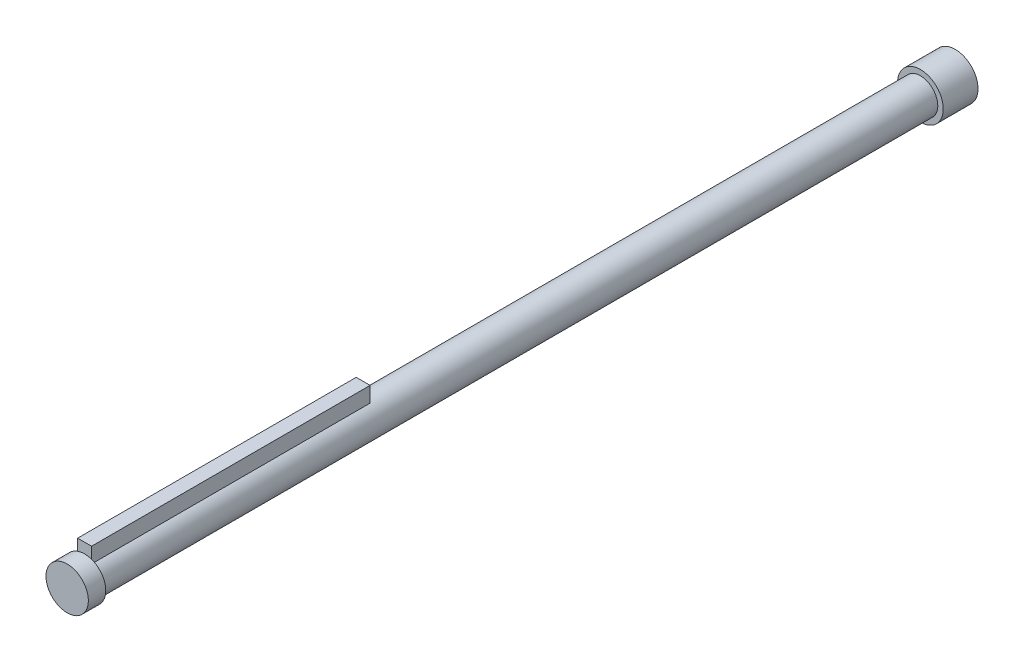
from build123d import *

# Parameters (mm, degrees)
SKETCH1_R           = 3.175
BOSS_EXTRUDE1_DEPTH = 152.4
SKETCH2_W           = 2.54
SKETCH2_H           = 5.08
BOSS_EXTRUDE4_DEPTH = 50.8
SKETCH3_R           = 4.162568093
BOSS_EXTRUDE5_DEPTH = 6.35
SKETCH4_R           = 3.861049132
BOSS_EXTRUDE6_DEPTH = 3.175


with BuildPart() as part:
    # Sketch1 → Boss-Extrude1 (new body)
    with BuildSketch(Plane.XY):
        Circle(SKETCH1_R)
    extrude(amount=BOSS_EXTRUDE1_DEPTH)

    # Sketch2 → Boss-Extrude4 (add)
    with BuildSketch(Plane.XY.offset(152.4)):
        with Locations((0, 3.175)):
            Rectangle(SKETCH2_W, SKETCH2_H)
    extrude(amount=-BOSS_EXTRUDE4_DEPTH)

    # Sketch3 → Boss-Extrude5 (add)
    with BuildSketch(Plane(origin=(0, 0, 0), x_dir=(-1, 0, 0), z_dir=(0, 0, -1))):
        Circle(SKETCH3_R)
    extrude(amount=BOSS_EXTRUDE5_DEPTH)

    # Sketch4 → Boss-Extrude6 (add)
    with BuildSketch(Plane.XY.offset(152.4)):
        Circle(SKETCH4_R)
    extrude(amount=BOSS_EXTRUDE6_DEPTH)


solid = part.part
